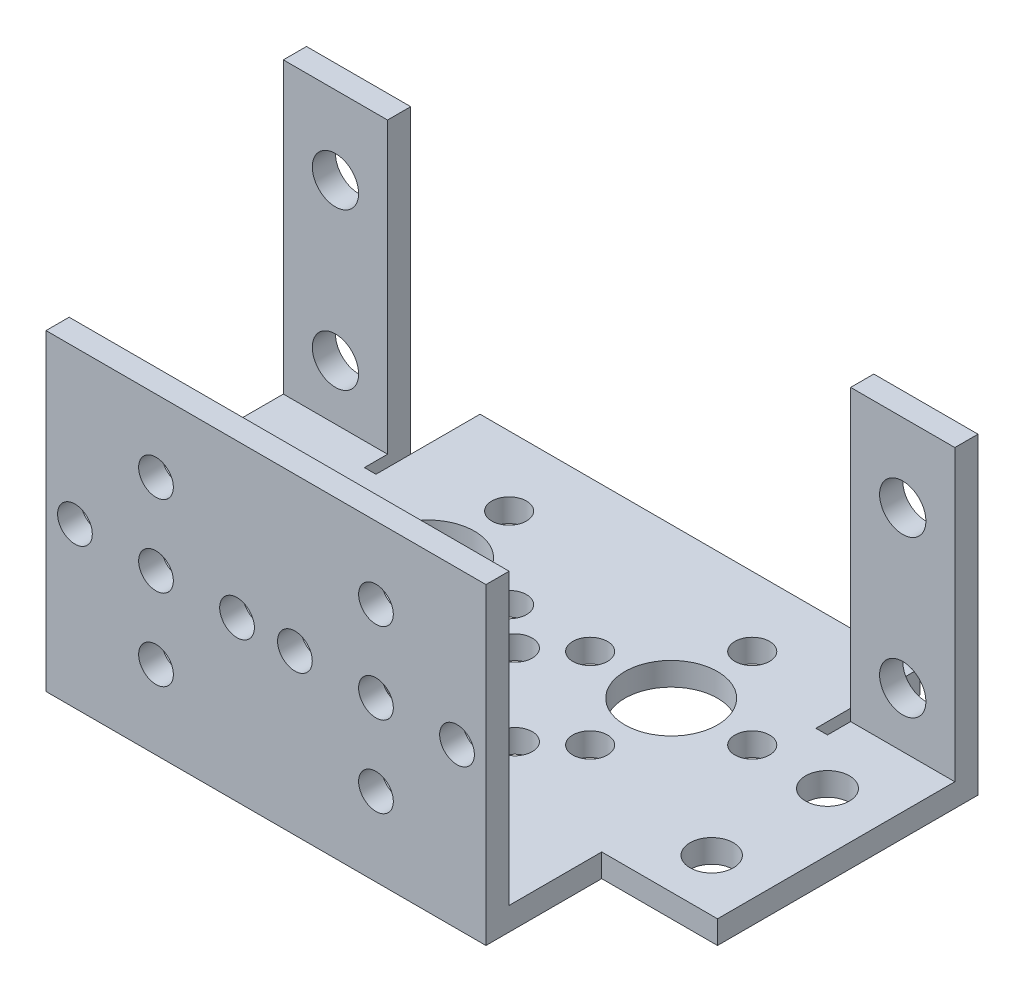
from build123d import *

# Parameters (mm, degrees)
SKETCH1_W           = 38
SKETCH1_H           = 35.49
BOSS_EXTRUDE1_DEPTH = 2
SKETCH3_W           = 10
SKETCH3_H           = 20.5
BOSS_EXTRUDE2_DEPTH = 2
SKETCH4_R           = 2
SKETCH4_R_2         = 1.893876917
SKETCH4_R_3         = 4
SKETCH4_R_4         = 1.5
SKETCH4_R_5         = 1.876990073
CUT_EXTRUDE1_DEPTH  = 2
SKETCH6_W           = 38
SKETCH6_H           = 27
BOSS_EXTRUDE3_DEPTH = 2
SKETCH7_R           = 1.5
CUT_EXTRUDE2_DEPTH  = 2
SKETCH8_W           = 9
SKETCH8_H           = 27
BOSS_EXTRUDE4_DEPTH = 2
SKETCH9_R           = 2
CUT_EXTRUDE3_DEPTH  = 2
SKETCH10_W          = 1
SKETCH10_H          = 2
CUT_EXTRUDE4_DEPTH  = 2


with BuildPart() as part:
    # Sketch1 → Boss-Extrude1 (new body)
    with BuildSketch(Plane(origin=(0, 0, 0), x_dir=(1, 0, 0), z_dir=(0, 1, 0))):
        Rectangle(SKETCH1_W, SKETCH1_H)
    extrude(amount=BOSS_EXTRUDE1_DEPTH)

    # Sketch3 → Boss-Extrude2 (add)
    with BuildSketch(Plane(origin=(0, 2, 0), x_dir=(1, 0, 0), z_dir=(0, 1, 0))):
        with Locations((24, 0.505)):
            Rectangle(SKETCH3_W, SKETCH3_H)
        with Locations((-24, 0.505)):
            Rectangle(SKETCH3_W, SKETCH3_H)
    extrude(amount=-BOSS_EXTRUDE2_DEPTH)

    # Sketch4 → Cut-Extrude1 (cut)
    with BuildSketch(Plane(origin=(0, 2, 0), x_dir=(1, 0, 0), z_dir=(0, 1, 0))):
        with Locations((-24, 4.755)):
            Circle(SKETCH4_R)
        with Locations((-24, -5.245)):
            Circle(SKETCH4_R)
        with Locations((24, 4.755)):
            Circle(SKETCH4_R_2)
        with Locations((-10.499999878, 4.757263723)):
            Circle(SKETCH4_R_3)
        with Locations((10.5, 4.755)):
            Circle(SKETCH4_R_3)
        with Locations((0, -5.245)):
            Circle(SKETCH4_R_3)
        with Locations((-10.499999878, 11.757263723)):
            Circle(SKETCH4_R_4)
        with Locations((-3.499999878, 4.757263723)):
            Circle(SKETCH4_R_4)
        with Locations((-10.499999878, -2.242736277)):
            Circle(SKETCH4_R_4)
        with Locations((-17.499999878, 4.757263723)):
            Circle(SKETCH4_R_4)
        with Locations((10.5, 11.755)):
            Circle(SKETCH4_R_4)
        with Locations((17.5, 4.755)):
            Circle(SKETCH4_R_4)
        with Locations((3.5, 4.755)):
            Circle(SKETCH4_R_4)
        with Locations((10.5, -2.245)):
            Circle(SKETCH4_R_4)
        with Locations((0, 1.755)):
            Circle(SKETCH4_R_4)
        with Locations((7, -5.245)):
            Circle(SKETCH4_R_4)
        with Locations((0, -12.245)):
            Circle(SKETCH4_R_4)
        with Locations((-7, -5.245)):
            Circle(SKETCH4_R_4)
        with Locations((24, -5.245)):
            Circle(SKETCH4_R_5)
    extrude(amount=-CUT_EXTRUDE1_DEPTH, mode=Mode.SUBTRACT)

    # Sketch6 → Boss-Extrude3 (add)
    with BuildSketch(Plane.XY.offset(17.745)):
        with Locations((0, 13.5)):
            Rectangle(SKETCH6_W, SKETCH6_H)
    extrude(amount=BOSS_EXTRUDE3_DEPTH)

    # Sketch7 → Cut-Extrude2 (cut)
    with BuildSketch(Plane.XY.offset(19.745)):
        with Locations((-9.5, 13.777414618)):
            Circle(SKETCH7_R)
        with Locations((9.5, 13.777414618)):
            Circle(SKETCH7_R)
        with Locations((-9.5, 20.777414618)):
            Circle(SKETCH7_R)
        with Locations((-9.5, 6.777414618)):
            Circle(SKETCH7_R)
        with Locations((-2.5, 13.777414618)):
            Circle(SKETCH7_R)
        with Locations((-16.5, 13.777414618)):
            Circle(SKETCH7_R)
        with Locations((16.5, 13.777414618)):
            Circle(SKETCH7_R)
        with Locations((9.5, 20.777414618)):
            Circle(SKETCH7_R)
        with Locations((2.5, 13.777414618)):
            Circle(SKETCH7_R)
        with Locations((9.5, 6.777414618)):
            Circle(SKETCH7_R)
    extrude(amount=-CUT_EXTRUDE2_DEPTH, mode=Mode.SUBTRACT)

    # Sketch8 → Boss-Extrude4 (add)
    with BuildSketch(Plane(origin=(0, 0, -10.755), x_dir=(-1, 0, 0), z_dir=(0, 0, -1))):
        with Locations((-24.5, 13.5)):
            Rectangle(SKETCH8_W, SKETCH8_H)
        with Locations((24.5, 13.5)):
            Rectangle(SKETCH8_W, SKETCH8_H)
    extrude(amount=BOSS_EXTRUDE4_DEPTH)

    # Sketch9 → Cut-Extrude3 (cut)
    with BuildSketch(Plane(origin=(0, 0, -12.755), x_dir=(-1, 0, 0), z_dir=(0, 0, -1))):
        with Locations((-24.5, 20.25)):
            Circle(SKETCH9_R)
        with Locations((-24.5, 6.75)):
            Circle(SKETCH9_R)
        with Locations((24.5, 20.25)):
            Circle(SKETCH9_R)
        with Locations((24.5, 6.75)):
            Circle(SKETCH9_R)
    extrude(amount=-CUT_EXTRUDE3_DEPTH, mode=Mode.SUBTRACT)

    # Sketch10 → Cut-Extrude4 (cut)
    with BuildSketch(Plane(origin=(0, 2, 0), x_dir=(1, 0, 0), z_dir=(0, 1, 0))):
        with Locations((-19.5, 9.755)):
            Rectangle(SKETCH10_W, SKETCH10_H)
        with Locations((19.5, 9.755)):
            Rectangle(SKETCH10_W, SKETCH10_H)
    extrude(amount=-CUT_EXTRUDE4_DEPTH, mode=Mode.SUBTRACT)


solid = part.part
